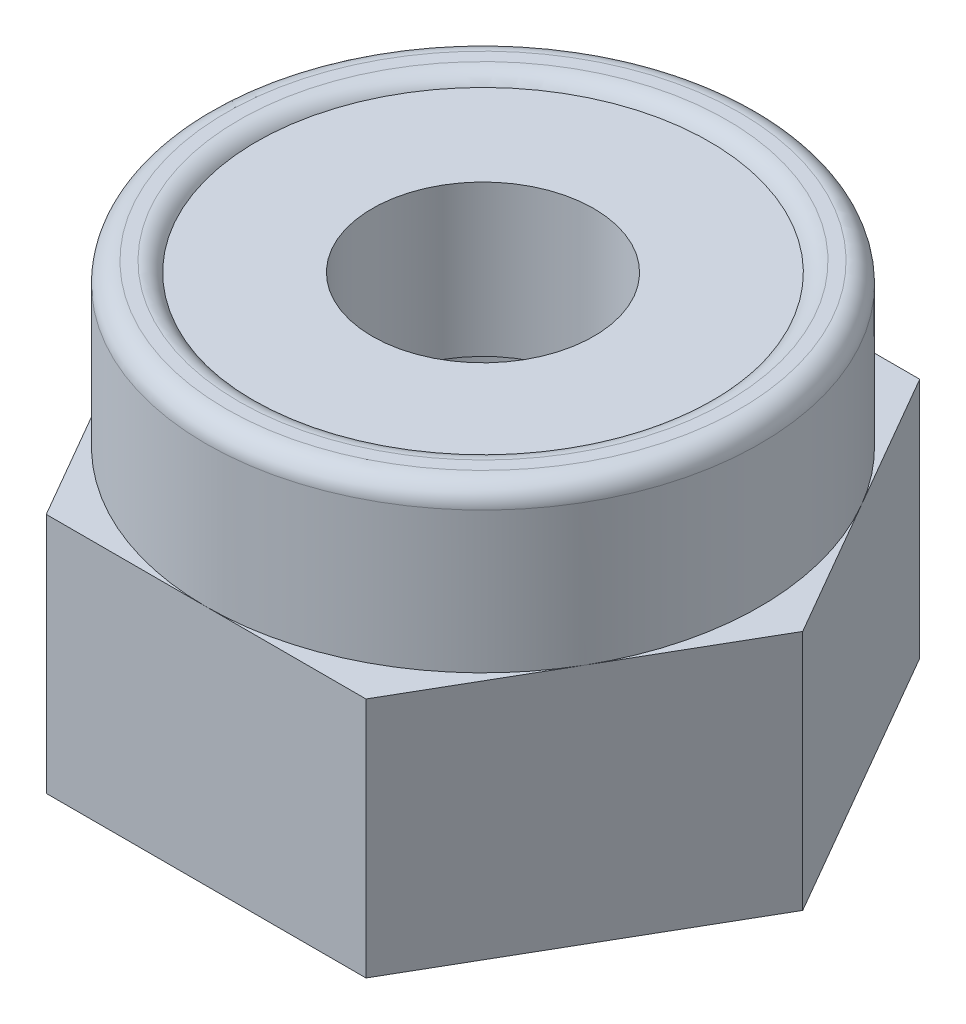
from build123d import *

# Parameters (mm, degrees)
CROQUIS1_R              = 1.25
SALIENTE_EXTRUIR1_DEPTH = 2.4
CROQUIS2_R              = 2.75
CROQUIS2_R_2            = 1.1
SALIENTE_EXTRUIR2_DEPTH = 1.6
CORTAR_EXTRUIR1_START   = -0.1
CROQUIS4_R              = 2.25
CROQUIS4_R_2            = 1.1
CORTAR_EXTRUIR1_DEPTH   = 0.1
REDONDEO1_R             = 0.2


with BuildPart() as part:
    # Croquis1 → Saliente-Extruir1 (new body)
    with BuildSketch(Plane(origin=(0, 0, 0), x_dir=(1, 0, 0), z_dir=(0, 1, 0))):
        Polygon((-1.58771324, 2.75), (-3.175426481, 0), (-1.58771324, -2.75), (1.58771324, -2.75), (3.175426481, 0), (1.58771324, 2.75), align=None)
        with Locations(Location((0, 0, 0), (0, 0, 270))):
            Circle(CROQUIS1_R, mode=Mode.SUBTRACT)
    extrude(amount=SALIENTE_EXTRUIR1_DEPTH)

    # Croquis2 → Saliente-Extruir2 (add)
    with BuildSketch(Plane(origin=(0, 2.4, 0), x_dir=(1, 0, 0), z_dir=(0, 1, 0))):
        with Locations(Location((0, 0, 0), (0, 0, 270))):
            Circle(CROQUIS2_R)
        with Locations(Location((0, 0, 0), (0, 0, 270))):
            Circle(CROQUIS2_R_2, mode=Mode.SUBTRACT)
    extrude(amount=SALIENTE_EXTRUIR2_DEPTH)

    # Croquis4 → Cortar-Extruir1 (cut)
    with BuildSketch(Plane(origin=(0, 4, 0), x_dir=(1, 0, 0), z_dir=(0, 1, 0)).offset(CORTAR_EXTRUIR1_START)):
        with Locations(Location((0, 0, 0), (0, 0, 270))):
            Circle(CROQUIS4_R)
        with Locations(Location((0, 0, 0), (0, 0, 270))):
            Circle(CROQUIS4_R_2, mode=Mode.SUBTRACT)
    extrude(amount=CORTAR_EXTRUIR1_DEPTH, mode=Mode.SUBTRACT)

    # Redondeo1
    # the kernel refuses this fillet: 0.2 mm, written as the material it takes off along each edge
    with BuildSketch(Plane(origin=(0, 4, 0), x_dir=(0, 0, 1), z_dir=(-1, 0, 0))) as redondeo1_piece_1:
        with BuildLine():
            CenterArc((2.75 - REDONDEO1_R, -REDONDEO1_R), REDONDEO1_R, 0, 90)
            Line((2.75 - REDONDEO1_R, 0), (2.75 - REDONDEO1_R, REDONDEO1_R * 0.02))
            Line((2.75 - REDONDEO1_R, REDONDEO1_R * 0.02), (2.75 + REDONDEO1_R * 0.02, REDONDEO1_R * 0.02))
            Line((2.75 + REDONDEO1_R * 0.02, REDONDEO1_R * 0.02), (2.75 + REDONDEO1_R * 0.02, -REDONDEO1_R))
            Line((2.75 + REDONDEO1_R * 0.02, -REDONDEO1_R), (2.75, -REDONDEO1_R))
        make_face()
    revolve(axis=Axis((0, 4, 0), (0, 1, 0)), mode=Mode.SUBTRACT)
    with BuildSketch(Plane(origin=(0, 4, 0), x_dir=(0, 0, 1), z_dir=(-1, 0, 0))) as redondeo1_piece_2:
        with BuildLine():
            CenterArc((2.423205081, -0.2), REDONDEO1_R, 90, 60)
            Line((2.25, -0.1), (2.246535898, -0.098))
            ThreePointArc((2.246535898, -0.098), (2.246, -0.05), (2.246, 0))
            Line((2.246, 0), (2.25, 0.004))
            Line((2.25, 0.004), (2.423205081, 0.004))
            Line((2.423205081, 0.004), (2.423205081, 0))
        make_face()
    revolve(axis=Axis((0, 4, 0), (0, 1, 0)), mode=Mode.SUBTRACT)


solid = part.part
